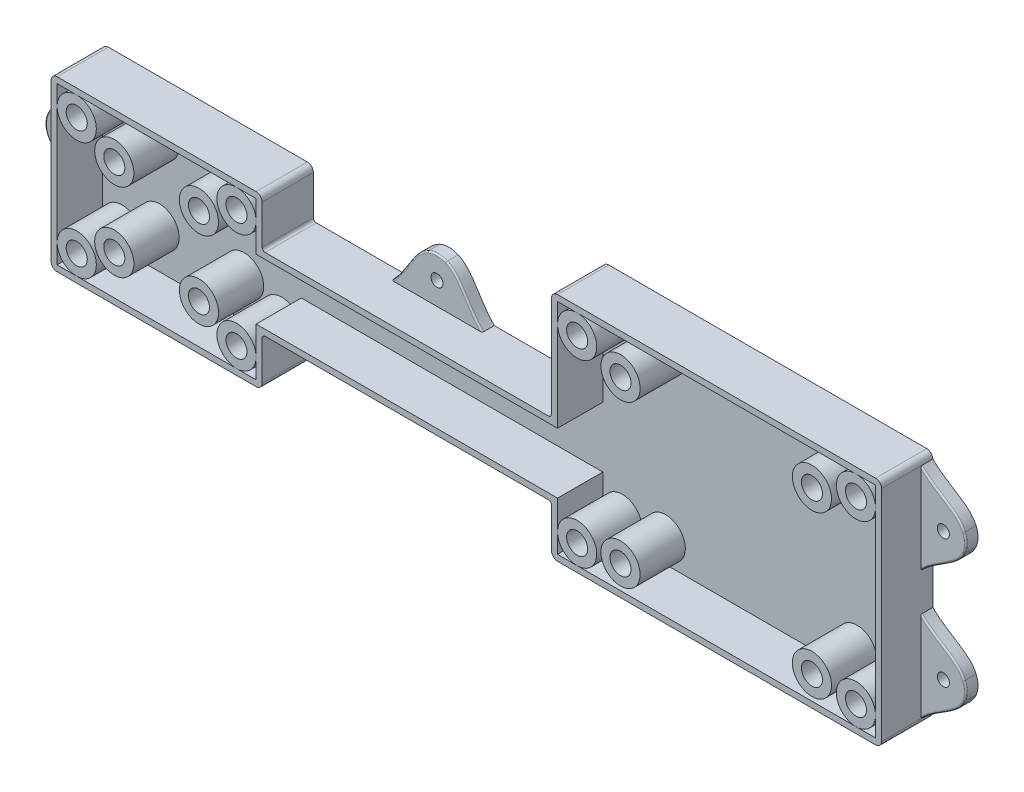
from build123d import *

# Parameters (mm, degrees)
BOSS_EXTRUDE1_DEPTH      = 2
SKETCH5_R                = 6.5
SKETCH5_R_2              = 3.5
EXTRUDE_THIN1_DEPTH      = 15
SKETCH6_R                = 6.5
SKETCH6_R_2              = 3.5
BOSS_EXTRUDE2_DEPTH      = 15
SKETCH11_R               = 6.5
SKETCH11_R_2             = 3.5
BOSS_EXTRUDE3_DEPTH      = 15
BOSS_EXTRUDE14_DEPTH     = 17
SKETCH16_R               = 2
BOSS_EXTRUDE15_DEPTH     = 4
BOSS_EXTRUDE17_START     = -4
BOSS_EXTRUDE17_OUTLINE_R = 2
BOSS_EXTRUDE17_DEPTH     = 4
FILLET2_R                = 1
FILLET3_R                = 0.5
FILLET4_R                = 0.5
FILLET5_R                = 0.5
FILLET6_R                = 0.5
FILLET7_R                = 2


# Read off the part's stored shape, not the designer's step: Boss-Extrude17
with BuildPart() as part:
    # Sketch4 → Boss-Extrude1 (new body)
    with BuildSketch(Plane.XY):
        Polygon((-34.644735585, 99.973245598), (70.837665542, 99.973245598), (70.837665542, 27.349991078), (-34.644735585, 27.349991078), (-34.644735585, 43.500421288), (-134.644735585, 43.500421288), (-134.644735585, 27.500421288), (-200.651447356, 27.500421288), (-200.651447356, 79.563245598), (-134.644735585, 79.563245598), (-134.644735585, 63.563245598), (-34.644735585, 63.563245598), align=None)
    extrude(amount=BOSS_EXTRUDE1_DEPTH)

    # Sketch5 → Extrude-Thin1 (add)
    # profile 1 of 4: a face of its own
    with BuildSketch(Plane.XY.offset(2)):
        with Locations((49.732767886, 88.676166549)):
            Circle(SKETCH5_R)
        with Locations((49.732767886, 88.676166549)):
            Circle(SKETCH5_R_2, mode=Mode.SUBTRACT)
    # profile 2 of 4: a face of its own
    with BuildSketch(Plane.XY.offset(2)):
        with Locations((-13.767232114, 88.676166549)):
            Circle(SKETCH5_R)
        with Locations((-13.767232114, 88.676166549)):
            Circle(SKETCH5_R_2, mode=Mode.SUBTRACT)
    # profile 3 of 4: a face of its own
    with BuildSketch(Plane.XY.offset(2)):
        with Locations((-13.767232114, 35.176166549)):
            Circle(SKETCH5_R)
        with Locations((-13.767232114, 35.176166549)):
            Circle(SKETCH5_R_2, mode=Mode.SUBTRACT)
    # profile 4 of 4: a face of its own
    with BuildSketch(Plane.XY.offset(2)):
        with Locations((49.732767886, 35.176166549)):
            Circle(SKETCH5_R)
        with Locations((49.732767886, 35.176166549)):
            Circle(SKETCH5_R_2, mode=Mode.SUBTRACT)
    extrude(amount=EXTRUDE_THIN1_DEPTH)

    # Sketch6 → Boss-Extrude2 (add)
    # profile 1 of 4: a face of its own
    with BuildSketch(Plane.XY.offset(2)):
        with Locations(Location((-28.144735585, 93.473245598, 0), (0, 0, 180))):
            Circle(SKETCH6_R)
        with Locations((-28.144735585, 93.473245598)):
            Circle(SKETCH6_R_2, mode=Mode.SUBTRACT)
    # profile 2 of 4: a face of its own
    with BuildSketch(Plane.XY.offset(2)):
        with Locations((64.337665542, 93.473245598)):
            Circle(SKETCH6_R)
        with Locations((64.337665542, 93.473245598)):
            Circle(SKETCH6_R_2, mode=Mode.SUBTRACT)
    # profile 3 of 4: a face of its own
    with BuildSketch(Plane.XY.offset(2)):
        with Locations((64.337665542, 33.849991078)):
            Circle(SKETCH6_R)
        with Locations((64.337665542, 33.849991078)):
            Circle(SKETCH6_R_2, mode=Mode.SUBTRACT)
    # profile 4 of 4: a face of its own
    with BuildSketch(Plane.XY.offset(2)):
        with Locations(Location((-28.144735585, 33.849991078, 0), (0, 0, 180))):
            Circle(SKETCH6_R)
        with Locations((-28.144735585, 33.849991078)):
            Circle(SKETCH6_R_2, mode=Mode.SUBTRACT)
    extrude(amount=BOSS_EXTRUDE2_DEPTH)

    # Sketch11 → Boss-Extrude3 (add)
    # profile 1 of 8: a face of its own
    with BuildSketch(Plane.XY.offset(2)):
        with Locations(Location((-194.151447356, 73.063245598, 0), (0, 0, 180))):
            Circle(SKETCH11_R)
        with Locations((-194.151447356, 73.063245598)):
            Circle(SKETCH11_R_2, mode=Mode.SUBTRACT)
    # profile 2 of 8: a face of its own
    with BuildSketch(Plane.XY.offset(2)):
        with Locations(Location((-181.690823906, 66.531833443, 0), (0, 0, 180))):
            Circle(SKETCH11_R)
        with Locations((-181.690823906, 66.531833443)):
            Circle(SKETCH11_R_2, mode=Mode.SUBTRACT)
    # profile 3 of 8: a face of its own
    with BuildSketch(Plane.XY.offset(2)):
        with Locations(Location((-153.605359035, 66.531833443, 0), (0, 0, 180))):
            Circle(SKETCH11_R)
        with Locations((-153.605359035, 66.531833443)):
            Circle(SKETCH11_R_2, mode=Mode.SUBTRACT)
    # profile 4 of 8: a face of its own
    with BuildSketch(Plane.XY.offset(2)):
        with Locations((-141.144735585, 73.063245598)):
            Circle(SKETCH11_R)
        with Locations((-141.144735585, 73.063245598)):
            Circle(SKETCH11_R_2, mode=Mode.SUBTRACT)
    # profile 5 of 8: a face of its own
    with BuildSketch(Plane.XY.offset(2)):
        with Locations(Location((-153.605359035, 40.531833443, 0), (0, 0, 180))):
            Circle(SKETCH11_R)
        with Locations((-153.605359035, 40.531833443)):
            Circle(SKETCH11_R_2, mode=Mode.SUBTRACT)
    # profile 6 of 8: a face of its own
    with BuildSketch(Plane.XY.offset(2)):
        with Locations((-141.144735585, 34.000421288)):
            Circle(SKETCH11_R)
        with Locations((-141.144735585, 34.000421288)):
            Circle(SKETCH11_R_2, mode=Mode.SUBTRACT)
    # profile 7 of 8: a face of its own
    with BuildSketch(Plane.XY.offset(2)):
        with Locations(Location((-194.151447356, 34.000421288, 0), (0, 0, 180))):
            Circle(SKETCH11_R)
        with Locations((-194.151447356, 34.000421288)):
            Circle(SKETCH11_R_2, mode=Mode.SUBTRACT)
    # profile 8 of 8: a face of its own
    with BuildSketch(Plane.XY.offset(2)):
        with Locations(Location((-181.690823906, 40.531833443, 0), (0, 0, 180))):
            Circle(SKETCH11_R)
        with Locations((-181.690823906, 40.531833443)):
            Circle(SKETCH11_R_2, mode=Mode.SUBTRACT)
    extrude(amount=BOSS_EXTRUDE3_DEPTH)


with BuildPart() as body_2:
    # Sketch15 → Boss-Extrude14 (new body)
    with BuildSketch(Plane(origin=(0, 0, 0), x_dir=(-1, 0, 0), z_dir=(0, 0, -1))):
        Polygon((202.651447356, 81.563245598), (132.644735585, 81.563245598), (132.644735585, 65.563245598), (36.644735585, 65.563245598), (36.644735585, 101.973245598), (-72.837665542, 101.973245598), (-72.837665542, 25.349991078), (36.644735585, 25.349991078), (36.644735585, 41.500421288), (132.644735585, 41.500421288), (132.644735585, 25.500421288), (202.651447356, 25.500421288), align=None)
        Polygon((200.651447356, 79.563245598), (134.644735585, 79.563245598), (134.644735585, 63.563245598), (34.644735585, 63.563245598), (34.644735585, 99.973245598), (-70.837665542, 99.973245598), (-70.837665542, 27.349991078), (34.644735585, 27.349991078), (34.644735585, 43.500421288), (134.644735585, 43.500421288), (134.644735585, 27.500421288), (200.651447356, 27.500421288), align=None, mode=Mode.SUBTRACT)
    extrude(amount=-BOSS_EXTRUDE14_DEPTH)

    # Sketch16 → Boss-Extrude15 (add)
    with BuildSketch(Plane(origin=(0, 0, 0), x_dir=(-1, 0, 0), z_dir=(0, 0, -1))):
        with BuildLine():
            add(Edge.make_bspline(
                [(217.000079168, 50.102209232), (215.914526778, 47.670363125), (210.793664019, 43.803750587), (205.372073117, 40.840025685), (202.651447356, 38.159371692)],
                knots=[0, 0, 0, 0, 0.400528179, 1, 1, 1, 1], degree=3))
            ThreePointArc((217.000079168, 50.102209232), (217.651447356, 53.159371692), (217.000079168, 56.216534152))
            add(Edge.make_bspline(
                [(217.000079168, 56.216534152), (215.914526778, 58.648380259), (210.793664019, 62.514992797), (205.372073117, 65.478717699), (202.651447356, 68.159371692)],
                knots=[0, 0, 0, 0, 0.400528179, 1, 1, 1, 1], degree=3))
            Line((202.651447356, 68.159371692), (202.651447356, 38.159371692))
        make_face()
        with Locations((210.151447356, 53.159371692)):
            Circle(SKETCH16_R, mode=Mode.SUBTRACT)
    extrude(amount=-BOSS_EXTRUDE15_DEPTH)

    # Fillet2
    fillet2_edges = [body_2.edges().sort_by_distance(p)[0] for p in [
        (-132.644735585, 41.500421288, 8.5),
        (-36.644735585, 41.500421288, 8.5),
        (-36.644735585, 65.563245598, 8.5),
        (-132.644735585, 65.563245598, 8.5),
    ]]
    fillet(fillet2_edges, radius=FILLET2_R)

    # Fillet3
    fillet3_edges = [body_2.edges().sort_by_distance(p)[0] for p in [
        (-210.244120001, 62.593553021, 4),
        (-217.651447356, 53.159371692, 4),
        (-210.244120001, 43.725190363, 4),
    ]]
    fillet(fillet3_edges, radius=FILLET3_R)

    # Fillet7
    fillet7_edges = [body_2.edges().sort_by_distance(p)[0] for p in [
        (-202.651447356, 25.500421288, 8.5),
        (-132.644735585, 25.500421288, 8.5),
        (-36.644735585, 25.349991078, 8.5),
        (72.837665542, 25.349991078, 8.5),
        (72.837665542, 101.973245598, 8.5),
        (-36.644735585, 101.973245598, 8.5),
        (-132.644735585, 81.563245598, 8.5),
        (-202.651447356, 81.563245598, 8.5),
    ]]
    fillet(fillet7_edges, radius=FILLET7_R)


with BuildPart() as body_3:
    # Boss-Extrude17 outline → Boss-Extrude17 (new body)
    # profile 1 of 3: a face of its own
    with BuildSketch(Plane(origin=(0, 0, 0), x_dir=(-1, 0, 0), z_dir=(0, 0, -1)).offset(BOSS_EXTRUDE17_START)):
        with BuildLine():
            add(Edge.make_bspline(
                [(-87.186297354, 45.407153538), (-86.100744964, 47.838999644), (-80.979882205, 51.705612183), (-75.558291303, 54.669337085), (-72.837665542, 57.349991078)],
                knots=[0, 0, 0, 0, 0.400528179, 1, 1, 1, 1], degree=3))
            ThreePointArc((-87.186297354, 45.407153538), (-87.837665542, 42.349991078), (-87.186297354, 39.292828617))
            add(Edge.make_bspline(
                [(-87.186297354, 39.292828617), (-86.100744964, 36.860982511), (-80.979882205, 32.994369972), (-75.558291303, 30.03064507), (-72.837665542, 27.349991078)],
                knots=[0, 0, 0, 0, 0.400528179, 1, 1, 1, 1], degree=3))
            Line((-72.837665542, 27.349991078), (-72.837665542, 57.349991078))
        make_face()
        with Locations((-80.337665542, 42.349991078)):
            Circle(BOSS_EXTRUDE17_OUTLINE_R, mode=Mode.SUBTRACT)
    # profile 2 of 3: a face of its own
    with BuildSketch(Plane(origin=(0, 0, 0), x_dir=(-1, 0, 0), z_dir=(0, 0, -1)).offset(BOSS_EXTRUDE17_START)):
        with BuildLine():
            add(Edge.make_bspline(
                [(-87.186297354, 88.030408058), (-86.100744964, 90.462254164), (-80.979882205, 94.328866703), (-75.558291303, 97.292591605), (-72.837665542, 99.973245598)],
                knots=[0, 0, 0, 0, 0.400528179, 1, 1, 1, 1], degree=3))
            ThreePointArc((-87.186297354, 88.030408058), (-87.837665542, 84.973245597), (-87.186297354, 81.916083137))
            add(Edge.make_bspline(
                [(-87.186297354, 81.916083137), (-86.100744964, 79.484237031), (-80.979882205, 75.617624492), (-75.558291303, 72.65389959), (-72.837665542, 69.973245598)],
                knots=[0, 0, 0, 0, 0.400528179, 1, 1, 1, 1], degree=3))
            Line((-72.837665542, 69.973245598), (-72.837665542, 99.973245598))
        make_face()
        with Locations((-80.337665542, 84.973245598)):
            Circle(BOSS_EXTRUDE17_OUTLINE_R, mode=Mode.SUBTRACT)
    # profile 3 of 3: a face of its own
    with BuildSketch(Plane(origin=(0, 0, 0), x_dir=(-1, 0, 0), z_dir=(0, 0, -1)).offset(BOSS_EXTRUDE17_START)):
        with BuildLine():
            add(Edge.make_bspline(
                [(90.7028669, 79.911877409), (93.134713006, 78.82632502), (97.001325545, 73.70546226), (99.965050447, 68.283871358), (102.64570444, 65.563245598)],
                knots=[0, 0, 0, 0, 0.400528179, 1, 1, 1, 1], degree=3))
            ThreePointArc((90.7028669, 79.911877409), (87.645704439, 80.563245598), (84.588541979, 79.911877409))
            add(Edge.make_bspline(
                [(84.588541979, 79.911877409), (82.156695873, 78.82632502), (78.290083334, 73.70546226), (75.326358432, 68.283871358), (72.64570444, 65.563245598)],
                knots=[0, 0, 0, 0, 0.400528179, 1, 1, 1, 1], degree=3))
            Line((72.64570444, 65.563245598), (102.64570444, 65.563245598))
        make_face()
        with Locations((87.64570444, 73.063245598)):
            Circle(BOSS_EXTRUDE17_OUTLINE_R, mode=Mode.SUBTRACT)
    extrude(amount=BOSS_EXTRUDE17_DEPTH)

    # Fillet4
    fillet4_edges = [body_3.edges().sort_by_distance(p)[0] for p in [
        (-78.211523111, 73.155918242, 4),
        (-97.079885768, 73.155918242, 4),
        (-87.645704439, 80.563245598, 4),
    ]]
    fillet(fillet4_edges, radius=FILLET4_R)

    # Fillet5
    fillet5_edges = [body_3.edges().sort_by_distance(p)[0] for p in [
        (80.430338187, 75.539064269, 4),
        (80.430338187, 94.407426926, 4),
        (87.837665542, 84.973245597, 4),
    ]]
    fillet(fillet5_edges, radius=FILLET5_R)

    # Fillet6
    fillet6_edges = [body_3.edges().sort_by_distance(p)[0] for p in [
        (80.430338187, 32.915809749, 4),
        (80.430338187, 51.784172406, 4),
        (87.837665542, 42.349991078, 4),
    ]]
    fillet(fillet6_edges, radius=FILLET6_R)


solid = Compound([part.part, body_2.part, body_3.part])
